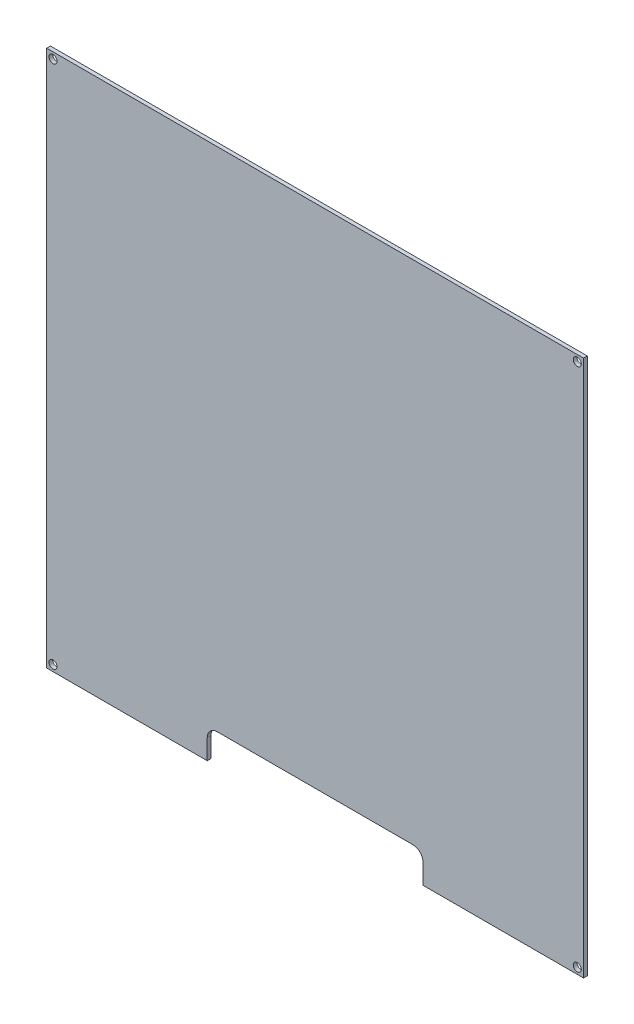
from build123d import *

# Parameters (mm, degrees)
SKETCH1_W           = 214
SKETCH1_H           = 214
SKETCH1_R           = 1.6
BOSS_EXTRUDE1_DEPTH = 1.5
SKETCH2_W           = 86
SKETCH2_H           = 12
CUT_EXTRUDE1_DEPTH  = 152.328285525
FILLET1_R           = 4


with BuildPart() as part:
    # Sketch1 → Boss-Extrude1 (new body)
    with BuildSketch(Plane.XY):
        Rectangle(SKETCH1_W, SKETCH1_H)
        with Locations((-104.5, 104.5)):
            Circle(SKETCH1_R, mode=Mode.SUBTRACT)
        with Locations((104.5, 104.5)):
            Circle(SKETCH1_R, mode=Mode.SUBTRACT)
        with Locations((0, -104.5)):
            Circle(SKETCH1_R, mode=Mode.SUBTRACT)
        with Locations((104.5, -104.5)):
            Circle(SKETCH1_R, mode=Mode.SUBTRACT)
        with Locations((-104.5, -104.5)):
            Circle(SKETCH1_R, mode=Mode.SUBTRACT)
    extrude(amount=BOSS_EXTRUDE1_DEPTH)

    # Sketch2 → Cut-Extrude1 (cut, through all)
    with BuildSketch(Plane.XY.offset(1.5)):
        with Locations((0, -101)):
            Rectangle(SKETCH2_W, SKETCH2_H)
    extrude(amount=-CUT_EXTRUDE1_DEPTH, mode=Mode.SUBTRACT)

    # Fillet1
    fillet1_edges = [part.edges().sort_by_distance(p)[0] for p in [
        (43, -95, 0.75),
        (-43, -95, 0.75),
    ]]
    fillet(fillet1_edges, radius=FILLET1_R)


solid = part.part
